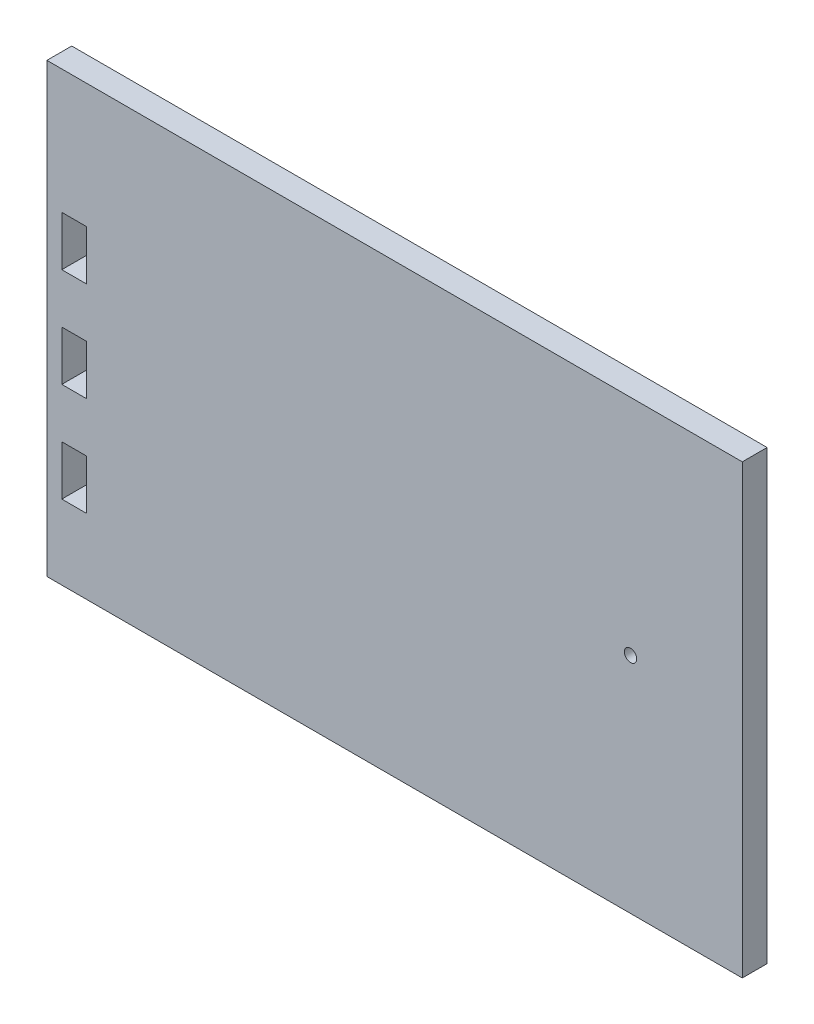
from build123d import *

# Parameters (mm, degrees)
SKETCH2_W           = 355.6
SKETCH2_H           = 228.6
BOSS_EXTRUDE1_DEPTH = 12.7
SKETCH3_R           = 3.175
CUT_EXTRUDE1_DEPTH  = 12.7
SKETCH4_W           = 12.7
SKETCH4_H           = 25.4
CUT_EXTRUDE2_DEPTH  = 423.930975456


with BuildPart() as part:
    # Sketch2 → Boss-Extrude1 (new body)
    with BuildSketch(Plane.XY):
        with Locations((177.8, -114.3)):
            Rectangle(SKETCH2_W, SKETCH2_H)
    extrude(amount=BOSS_EXTRUDE1_DEPTH)

    # Sketch3 → Cut-Extrude1 (cut)
    with BuildSketch(Plane.XY.offset(12.7)):
        with Locations((298.45, -114.3)):
            Circle(SKETCH3_R)
    extrude(amount=-CUT_EXTRUDE1_DEPTH, mode=Mode.SUBTRACT)

    # Sketch4 → Cut-Extrude2 (cut, through all)
    with BuildSketch(Plane.XY.offset(12.7)):
        with Locations((13.97, -76.2)):
            Rectangle(SKETCH4_W, SKETCH4_H)
        with Locations((13.97, -127)):
            Rectangle(SKETCH4_W, SKETCH4_H)
        with Locations((13.97, -177.8)):
            Rectangle(SKETCH4_W, SKETCH4_H)
    extrude(amount=-CUT_EXTRUDE2_DEPTH, mode=Mode.SUBTRACT)


solid = part.part
